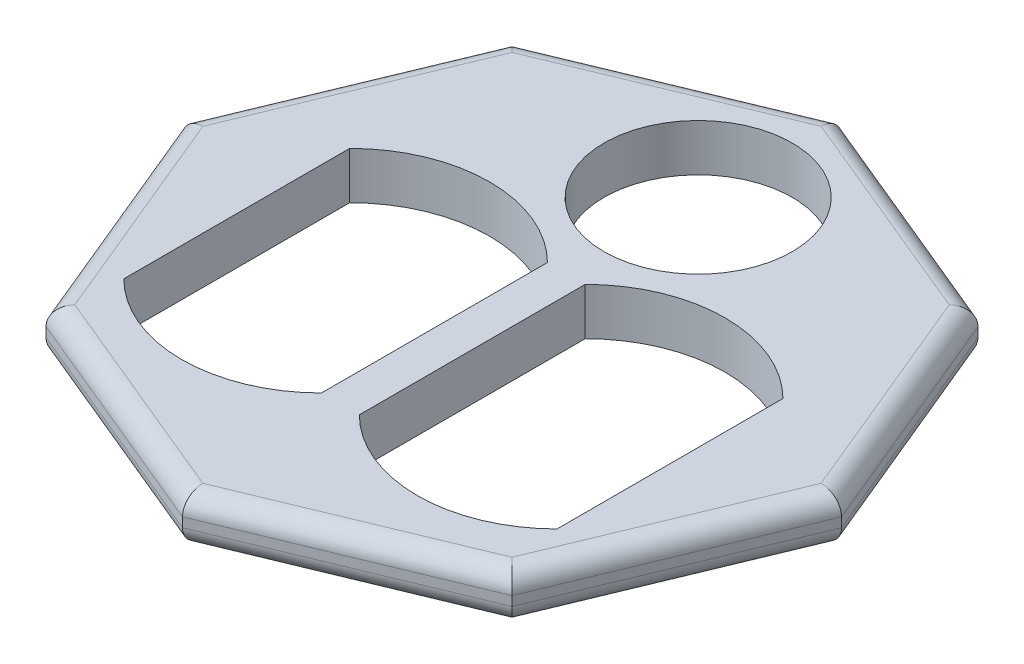
from build123d import *

# Parameters (mm, degrees)
BOSS_EXTRUDE1_DEPTH = 5
SKETCH4_W           = 21
SKETCH4_H           = 24
CUT_EXTRUDE1_DEPTH  = 5
CUT_EXTRUDE2_DEPTH  = 5
SKETCH10_W          = 47.253020793
SKETCH10_H          = 79.148030785
CUT_EXTRUDE3_DEPTH  = 5
MIRROR8_DEPTH       = 5
SKETCH11_R          = 10
CUT_EXTRUDE4_DEPTH  = 5
FILLET5_R           = 2


# Read off the part's stored shape, not the designer's step: Mirror8
with BuildPart() as part:
    # Sketch3 → Boss-Extrude1 (new body)
    with BuildSketch(Plane(origin=(0, 0, 0), x_dir=(1, 0, 0), z_dir=(0, 1, 0))):
        Polygon((35, 0), (24.748737342, 24.748737342), (0, 35), (-24.748737342, 24.748737342), (-35, 0), (-24.748737342, -24.748737342), (0, -35), (24.748737342, -24.748737342), align=None)
    extrude(amount=BOSS_EXTRUDE1_DEPTH)

    # Sketch4 → Cut-Extrude1 (cut)
    with BuildSketch(Plane(origin=(0, 5, 0), x_dir=(1, 0, 0), z_dir=(0, 1, 0))):
        with Locations((-12.508622631, -6.229175633)):
            Rectangle(SKETCH4_W, SKETCH4_H)
    extrude(amount=-CUT_EXTRUDE1_DEPTH, mode=Mode.SUBTRACT)

    # Sketch4<6> → Cut-Extrude2 (cut)
    with BuildSketch(Plane(origin=(0, 5, 0), x_dir=(1, 0, 0), z_dir=(0, 1, 0))):
        with BuildLine():
            ThreePointArc((-23.008622631, 5.770824367), (-12.508622631, 10.120066772), (-2.008622631, 5.770824367))
            Line((-2.008622631, 5.770824367), (-23.008622631, 5.770824367))
        make_face()
        with BuildLine():
            Line((-23.008622631, -18.229175633), (-2.008622631, -18.229175633))
            ThreePointArc((-2.008622631, -18.229175633), (-12.508622631, -22.578418038), (-23.008622631, -18.229175633))
        make_face()
    extrude(amount=-CUT_EXTRUDE2_DEPTH, mode=Mode.SUBTRACT)

    # Sketch10 → Cut-Extrude3 (cut)
    with BuildSketch(Plane(origin=(0, 5, 0), x_dir=(1, 0, 0), z_dir=(0, 1, 0))):
        with Locations((23.626510397, -1.493894903)):
            Rectangle(SKETCH10_W, SKETCH10_H)
    extrude(amount=-CUT_EXTRUDE3_DEPTH, mode=Mode.SUBTRACT)

    # Mirror8 outline → Mirror8 (add)
    with BuildSketch(Plane(origin=(0, 0, 0), x_dir=(1, 0, 0), z_dir=(0, 1, 0))):
        Polygon((24.748737342, 24.748737342), (0, 35), (0, -35), (24.748737342, -24.748737342), (35, 0), align=None)
        with BuildLine():
            ThreePointArc((2.008622631, 5.770824367), (12.508622631, 10.120066772), (23.008622631, 5.770824367))
            Line((23.008622631, 5.770824367), (23.008622631, -18.229175633))
            ThreePointArc((23.008622631, -18.229175633), (12.508622631, -22.578418038), (2.008622631, -18.229175633))
            Line((2.008622631, -18.229175633), (2.008622631, 5.770824367))
        make_face(mode=Mode.SUBTRACT)
    extrude(amount=MIRROR8_DEPTH)

    # Sketch11 → Cut-Extrude4 (cut)
    with BuildSketch(Plane(origin=(0, 5, 0), x_dir=(1, 0, 0), z_dir=(0, 1, 0))):
        with Locations(Location((0, 19.772592196, 0), (0, 0, 270))):
            Circle(SKETCH11_R)
    extrude(amount=-CUT_EXTRUDE4_DEPTH, mode=Mode.SUBTRACT)

    # Fillet5
    fillet5_edges = [part.edges().sort_by_distance(p)[0] for p in [
        (-12.374368671, 5, -29.874368671),
        (-29.874368671, 5, -12.374368671),
        (-29.874368671, 5, 12.374368671),
        (-12.374368671, 5, 29.874368671),
        (12.374368671, 5, -29.874368671),
        (29.874368671, 5, -12.374368671),
        (29.874368671, 5, 12.374368671),
        (12.374368671, 0, -29.874368671),
        (29.874368671, 0, -12.374368671),
        (29.874368671, 0, 12.374368671),
        (12.374368671, 0, 29.874368671),
        (12.374368671, 5, 29.874368671),
        (-12.374368671, 0, 29.874368671),
        (-29.874368671, 0, 12.374368671),
        (-29.874368671, 0, -12.374368671),
        (-12.374368671, 0, -29.874368671),
    ]]
    fillet(fillet5_edges, radius=FILLET5_R)


solid = part.part
